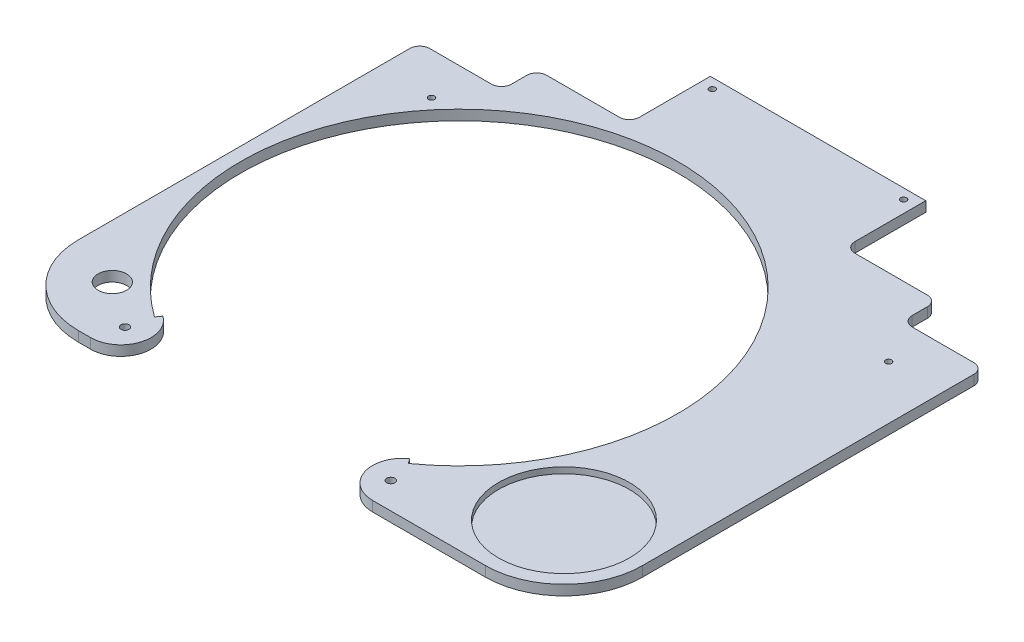
from build123d import *

# Parameters (mm, degrees)
ESQUISSE1_W              = 280.2
ESQUISSE1_H              = 276.282873123
BOSS_EXTRU_1_DEPTH       = 5
ENL_V_MAT_EXTRU_1_DEPTH  = 283.344868376
ENL_V_MAT_EXTRU_3_DEPTH  = 283.344868376
ESQUISSE5_R              = 2
ENL_V_MAT_EXTRU_4_DEPTH  = 283.344868376
ENL_V_MAT_EXTRU_5_DEPTH  = 283.344868376
ESQUISSE7_R              = 7.071067812
ENL_V_MAT_EXTRU_6_DEPTH  = 283.344868376
ESQUISSE8_R              = 1.5
ENL_V_MAT_EXTRU_8_DEPTH  = 283.344868376
ESQUISSE9_R              = 32.5
ENL_V_MAT_EXTRU_10_DEPTH = 3
ESQUISSE10_R             = 1.5
ENL_V_MAT_EXTRU_11_DEPTH = 283.344868376


with BuildPart() as part:
    # Esquisse1 → Boss.-Extru.1 (new body)
    with BuildSketch(Plane(origin=(0, 0, 0), x_dir=(1, 0, 0), z_dir=(0, 1, 0))):
        with Locations((0, -106.941436562)):
            Rectangle(ESQUISSE1_W, ESQUISSE1_H)
    extrude(amount=BOSS_EXTRU_1_DEPTH)

    # Esquisse2 → Enlèv. mat.-Extru.1 (cut, through all)
    with BuildSketch(Plane(origin=(0, 5, 0), x_dir=(1, 0, 0), z_dir=(0, 1, 0))):
        with BuildLine():
            Line((-86.286307054, -217.873386842), (-88.029045643, -220.315284098))
            ThreePointArc((-88.029045643, -220.315284098), (-128.330678708, -98.90890093), (-25, -23.5))
            ThreePointArc((-25, -23.5), (78.330678708, -98.90890093), (38.029045643, -220.315284098))
            Line((38.029045643, -220.315284098), (36.286307054, -217.873386842))
            ThreePointArc((36.286307054, -217.873386842), (30.714652713, -234.657679446), (45, -245.082873123))
            Line((45, -245.082873123), (-95, -245.082873123))
            ThreePointArc((-95, -245.082873123), (-80.714652713, -234.657679446), (-86.286307054, -217.873386842))
        make_face()
    extrude(amount=-ENL_V_MAT_EXTRU_1_DEPTH, mode=Mode.SUBTRACT)

    # Esquisse4 → Enlèv. mat.-Extru.3 (cut, through all)
    with BuildSketch(Plane(origin=(0, 5, 0), x_dir=(1, 0, 0), z_dir=(0, 1, 0))):
        with BuildLine():
            Line((140.1, -245.082873123), (101.1, -245.082873123))
            ThreePointArc((101.1, -245.082873123), (128.677164466, -233.660037589), (140.1, -206.082873123))
            Line((140.1, -206.082873123), (140.1, -245.082873123))
        make_face()
        with BuildLine():
            Line((-101.1, -245.082873123), (-140.1, -245.082873123))
            Line((-140.1, -245.082873123), (-140.1, -206.082873123))
            ThreePointArc((-140.1, -206.082873123), (-128.677164466, -233.660037589), (-101.1, -245.082873123))
        make_face()
    extrude(amount=-ENL_V_MAT_EXTRU_3_DEPTH, mode=Mode.SUBTRACT)

    # Esquisse5 → Enlèv. mat.-Extru.4 (cut, through all)
    with BuildSketch(Plane(origin=(0, 5, 0), x_dir=(1, 0, 0), z_dir=(0, 1, 0))):
        with Locations((-91, -232)):
            Circle(ESQUISSE5_R)
        with Locations((41, -232)):
            Circle(ESQUISSE5_R)
    extrude(amount=-ENL_V_MAT_EXTRU_4_DEPTH, mode=Mode.SUBTRACT)

    # Esquisse6 → Enlèv. mat.-Extru.5 (cut, through all)
    with BuildSketch(Plane(origin=(0, 5, 0), x_dir=(1, 0, 0), z_dir=(0, 1, 0))):
        with BuildLine():
            Line((140.1, 31.2), (0, 31.2))
            Line((0, 31.2), (-140.1, 31.2))
            Line((-140.1, 31.2), (-140.1, -41.5125))
            ThreePointArc((-140.1, -41.5125), (-138.635533906, -37.976966094), (-135.1, -36.5125))
            Line((-135.1, -36.5125), (-104.5, -36.5125))
            ThreePointArc((-104.5, -36.5125), (-100.964466094, -35.048033906), (-99.5, -31.5125))
            Line((-99.5, -31.5125), (-99.5, -24))
            ThreePointArc((-99.5, -24), (-98.035533906, -20.464466094), (-94.5, -19))
            Line((-94.5, -19), (-58.5, -19))
            ThreePointArc((-58.5, -19), (-54.964466094, -17.535533906), (-53.5, -14))
            Line((-53.5, -14), (-53.5, 21.2))
            Line((-53.5, 21.2), (53.5, 21.2))
            Line((53.5, 21.2), (53.5, -14))
            ThreePointArc((53.5, -14), (54.964466094, -17.535533906), (58.5, -19))
            Line((58.5, -19), (94.5, -19))
            ThreePointArc((94.5, -19), (98.035533906, -20.464466094), (99.5, -24))
            Line((99.5, -24), (99.5, -31.5125))
            ThreePointArc((99.5, -31.5125), (100.964466094, -35.048033906), (104.5, -36.5125))
            Line((104.5, -36.5125), (135.1, -36.5125))
            ThreePointArc((135.1, -36.5125), (138.635533906, -37.976966094), (140.1, -41.5125))
            Line((140.1, -41.5125), (140.1, 31.2))
        make_face()
    extrude(amount=-ENL_V_MAT_EXTRU_5_DEPTH, mode=Mode.SUBTRACT)

    # Esquisse7 → Enlèv. mat.-Extru.6 (cut, through all)
    with BuildSketch(Plane(origin=(0, 5, 0), x_dir=(1, 0, 0), z_dir=(0, 1, 0))):
        with Locations((-113.5, -215.8)):
            Circle(ESQUISSE7_R)
    extrude(amount=-ENL_V_MAT_EXTRU_6_DEPTH, mode=Mode.SUBTRACT)

    # Esquisse8 → Enlèv. mat.-Extru.8 (cut, through all)
    with BuildSketch(Plane.XZ):
        with Locations((47.5, -16.2)):
            Circle(ESQUISSE8_R)
        with Locations((-47.5, -16.2)):
            Circle(ESQUISSE8_R)
    extrude(amount=-ENL_V_MAT_EXTRU_8_DEPTH, mode=Mode.SUBTRACT)

    # Esquisse9 → Enlèv. mat.-Extru.10 (cut)
    with BuildSketch(Plane(origin=(0, 5, 0), x_dir=(1, 0, 0), z_dir=(0, 1, 0))):
        with Locations((101.1, -206.082873123)):
            Circle(ESQUISSE9_R)
    extrude(amount=-ENL_V_MAT_EXTRU_10_DEPTH, mode=Mode.SUBTRACT)

    # Esquisse10 → Enlèv. mat.-Extru.11 (cut, through all)
    with BuildSketch(Plane(origin=(0, 5, 0), x_dir=(1, 0, 0), z_dir=(0, 1, 0))):
        with Locations((113.5, -57.265046493)):
            Circle(ESQUISSE10_R)
        with Locations((-113.5, -57.265046493)):
            Circle(ESQUISSE10_R)
    extrude(amount=-ENL_V_MAT_EXTRU_11_DEPTH, mode=Mode.SUBTRACT)


solid = part.part
